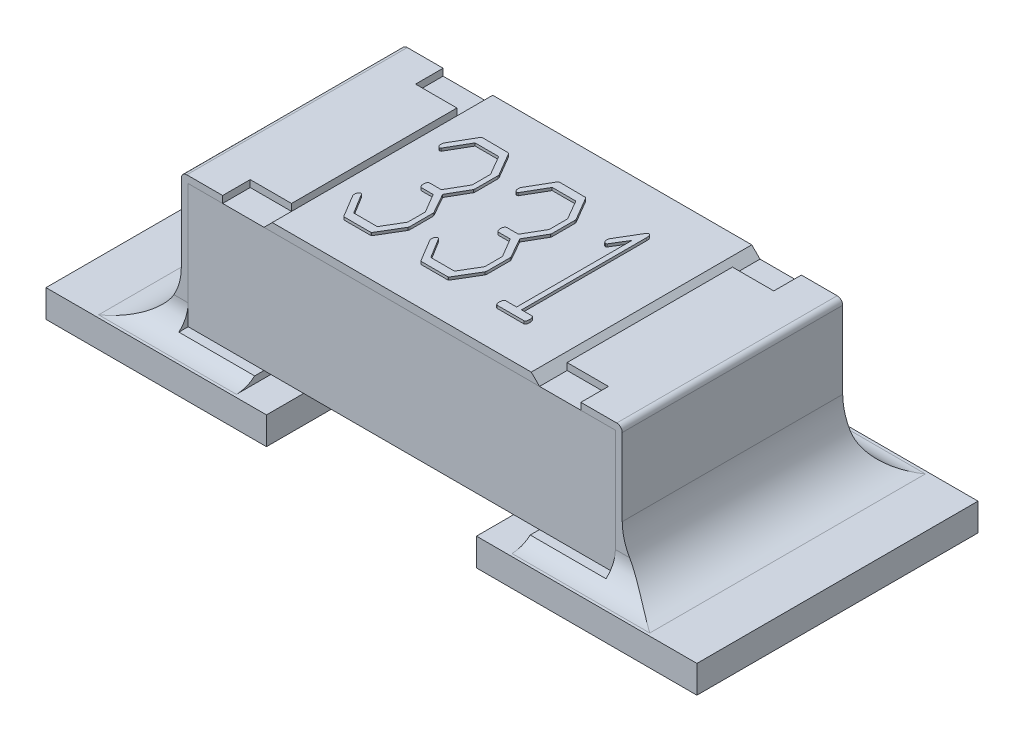
from build123d import *

# Parameters (mm, degrees)
SKETCH1_W             = 0.8
SKETCH1_H             = 0.45
BOSS_EXTRUDE1_DEPTH   = 0.775
BOSS_EXTRUDE2_DEPTH   = 0.4
BOSS_EXTRUDE2_2_DEPTH = 0.4
SKETCH3_W             = 0.15
SKETCH3_H             = 0.1
CUT_EXTRUDE1_DEPTH    = 0.025
BOSS_EXTRUDE3_DEPTH   = 0.4
BOSS_EXTRUDE4_DEPTH   = 0.01
SKETCH7_W             = 0.8
SKETCH7_H             = 1.02
BOSS_EXTRUDE5_DEPTH   = 0.1
FILLET3_R             = 0.2
FILLET4_R             = 0.2
FILLET5_R             = 0.1
FILLET6_R             = 0.1


with BuildPart() as part:
    # Sketch1 → Boss-Extrude1 (new, symmetric)
    with BuildSketch(Plane(origin=(0, 0, 0), x_dir=(0, 0, -1), z_dir=(1, 0, 0))):
        with Locations((0, 0.35)):
            Rectangle(SKETCH1_W, SKETCH1_H)
    extrude(amount=BOSS_EXTRUDE1_DEPTH, both=True)


with BuildPart() as body_2:
    # Sketch2 → Boss-Extrude2 (new, symmetric)
    with BuildSketch(Plane.XY):
        with BuildLine():
            Line((-0.5, 0.6), (-0.78, 0.6))
            ThreePointArc((-0.78, 0.6), (-0.794142136, 0.594142136), (-0.8, 0.58))
            Line((-0.8, 0.58), (-0.8, 0.1))
            Line((-0.8, 0.1), (-0.5, 0.1))
            Line((-0.5, 0.1), (-0.5, 0.125))
            Line((-0.5, 0.125), (-0.775, 0.125))
            Line((-0.775, 0.125), (-0.775, 0.575))
            Line((-0.775, 0.575), (-0.5, 0.575))
            Line((-0.5, 0.575), (-0.5, 0.6))
        make_face()
    extrude(amount=BOSS_EXTRUDE2_DEPTH, both=True)


with BuildPart() as body_3:
    # Sketch2 → Boss-Extrude2 2 (new, symmetric)
    with BuildSketch(Plane.XY):
        with BuildLine():
            Line((0.5, 0.575), (0.5, 0.6))
            Line((0.5, 0.6), (0.78, 0.6))
            ThreePointArc((0.78, 0.6), (0.794142136, 0.594142136), (0.8, 0.58))
            Line((0.8, 0.58), (0.8, 0.1))
            Line((0.8, 0.1), (0.5, 0.1))
            Line((0.5, 0.1), (0.5, 0.125))
            Line((0.5, 0.125), (0.775, 0.125))
            Line((0.775, 0.125), (0.775, 0.575))
            Line((0.775, 0.575), (0.5, 0.575))
        make_face()
    extrude(amount=BOSS_EXTRUDE2_2_DEPTH, both=True)


with BuildPart() as cut_extrude1_tool:
    # Sketch3 → Cut-Extrude1 (new body)
    with BuildSketch(Plane(origin=(0, 0.6, 0), x_dir=(1, 0, 0), z_dir=(0, 1, 0))):
        with Locations((-0.575, 0.35)):
            Rectangle(SKETCH3_W, SKETCH3_H)
        with Locations((-0.575, -0.35)):
            Rectangle(SKETCH3_W, SKETCH3_H)
        with Locations((0.575, -0.35)):
            Rectangle(SKETCH3_W, SKETCH3_H)
        with Locations((0.575, 0.35)):
            Rectangle(SKETCH3_W, SKETCH3_H)
    extrude(amount=-CUT_EXTRUDE1_DEPTH)


with BuildPart() as body_2_1:
    add(body_2.part)

    # Cut-Extrude1: cut by cut_extrude1_tool
    add(cut_extrude1_tool.part, mode=Mode.SUBTRACT)



with BuildPart() as body_3_1:
    add(body_3.part)

    # Cut-Extrude1: cut by cut_extrude1_tool
    add(cut_extrude1_tool.part, mode=Mode.SUBTRACT)


with BuildPart() as body_4:
    # Sketch4 → Boss-Extrude3 (new, symmetric)
    with BuildSketch(Plane.XY):
        Polygon((-0.5, 0.575), (0.5, 0.575), (0.47, 0.605), (-0.47, 0.605), align=None)
    extrude(amount=BOSS_EXTRUDE3_DEPTH, both=True)

    # Sketch6 → Boss-Extrude4 (add)
    with BuildSketch(Plane(origin=(0, 0.605, 0), x_dir=(1, 0, 0), z_dir=(0, 1, 0))):
        with BuildLine():
            Line((-0.246912202, 0.234002976), (-0.198456101, 0.151227679))
            Line((-0.198456101, 0.151227679), (-0.197619048, 0.145182292))
            Line((-0.197619048, 0.145182292), (-0.197619048, 0.063058036))
            Line((-0.197619048, 0.063058036), (-0.198828125, 0.058314732))
            Line((-0.198828125, 0.058314732), (-0.23937872, -0.012276786))
            Line((-0.23937872, -0.012276786), (-0.198828125, -0.084170387))
            Line((-0.198828125, -0.084170387), (-0.197619048, -0.08891369))
            Line((-0.197619048, -0.08891369), (-0.197619048, -0.172991071))
            Line((-0.197619048, -0.172991071), (-0.198828125, -0.178478423))
            Line((-0.198828125, -0.178478423), (-0.248214286, -0.26125372))
            Line((-0.248214286, -0.26125372), (-0.252213542, -0.261904762))
            Line((-0.252213542, -0.261904762), (-0.348195685, -0.261904762))
            Line((-0.348195685, -0.261904762), (-0.350613839, -0.259207589))
            Line((-0.350613839, -0.259207589), (-0.399627976, -0.177548363))
            add(Edge.make_bspline(
                [(-0.399627976, -0.177548363), (-0.399735366, -0.176681244), (-0.400006783, -0.174489697), (-0.400002555, -0.17228021), (-0.4, -0.17094494)],
                knots=[0, 0, 0, 0, 0.791330927, 2, 2, 2, 2], degree=3))
            add(Edge.make_bspline(
                [(-0.4, -0.17094494), (-0.400005712, -0.169980402), (-0.400014966, -0.168417682), (-0.399735103, -0.166882343), (-0.399627976, -0.166294643)],
                knots=[0, 0, 0, 0, 1.234435563, 2, 2, 2, 2], degree=3))
            add(Edge.make_bspline(
                [(-0.399627976, -0.166294643), (-0.399297743, -0.165050815), (-0.398689007, -0.162758001), (-0.396796108, -0.160041395), (-0.394746995, -0.157801232), (-0.392913317, -0.157262127), (-0.392001488, -0.156994048)],
                knots=[0, 0, 0, 0, 1.206652828, 2.224285909, 3.116994777, 4, 4, 4, 4], degree=3))
            add(Edge.make_bspline(
                [(-0.392001488, -0.156994048), (-0.390666654, -0.15729556), (-0.387649437, -0.157977088), (-0.386084599, -0.160689792), (-0.385212054, -0.162202381)],
                knots=[0, 0, 0, 0, 0.884811277, 2, 2, 2, 2], degree=3))
            Line((-0.385212054, -0.162202381), (-0.342243304, -0.232142857))
            Line((-0.342243304, -0.232142857), (-0.256491815, -0.232142857))
            Line((-0.256491815, -0.232142857), (-0.21547619, -0.16313244))
            Line((-0.21547619, -0.16313244), (-0.21547619, -0.098772321))
            Line((-0.21547619, -0.098772321), (-0.25639881, -0.029761905))
            Line((-0.25639881, -0.029761905), (-0.300390625, -0.029761905))
            add(Edge.make_bspline(
                [(-0.300390625, -0.029761905), (-0.301388222, -0.029049571), (-0.303450502, -0.027577), (-0.305383911, -0.023897974), (-0.30657995, -0.019363369), (-0.306667482, -0.015976601), (-0.30671503, -0.014136905)],
                knots=[0, 0, 0, 0, 0.823895179, 1.703194927, 2.752372739, 4, 4, 4, 4], degree=3))
            add(Edge.make_bspline(
                [(-0.30671503, -0.014136905), (-0.306591968, -0.012090481), (-0.306354099, -0.008134877), (-0.304715651, -0.004530053), (-0.303924851, -0.002790179)],
                knots=[0, 0, 0, 0, 1.034696418, 2, 2, 2, 2], degree=3))
            add(Edge.make_bspline(
                [(-0.303924851, -0.002790179), (-0.303111447, -0.001956226), (-0.301320079, -0.000119606), (-0.298733514, -4.2238e-05), (-0.297321429, 0)],
                knots=[0, 0, 0, 0, 0.908138185, 2, 2, 2, 2], degree=3))
            Line((-0.297321429, 0), (-0.25639881, 0))
            Line((-0.25639881, 0), (-0.21547619, 0.07077753))
            Line((-0.21547619, 0.07077753), (-0.21547619, 0.137555804))
            Line((-0.21547619, 0.137555804), (-0.256491815, 0.208333333))
            Line((-0.256491815, 0.208333333), (-0.342243304, 0.208333333))
            Line((-0.342243304, 0.208333333), (-0.387630208, 0.130208333))
            add(Edge.make_bspline(
                [(-0.387630208, 0.130208333), (-0.388357871, 0.129817639), (-0.389620694, 0.129139609), (-0.391031564, 0.128910385), (-0.391629464, 0.128813244)],
                knots=[0, 0, 0, 0, 1.152437574, 2, 2, 2, 2], degree=3))
            add(Edge.make_bspline(
                [(-0.391629464, 0.128813244), (-0.392807912, 0.129002619), (-0.39532525, 0.129407153), (-0.398122994, 0.132865271), (-0.399842375, 0.137855724), (-0.39994275, 0.14181055), (-0.4, 0.14406622)],
                knots=[0, 0, 0, 0, 0.723786097, 1.5461138, 2.600403721, 4, 4, 4, 4], degree=3))
            Line((-0.4, 0.14406622), (-0.399162946, 0.150297619))
            Line((-0.399162946, 0.150297619), (-0.349869792, 0.23530506))
            Line((-0.349869792, 0.23530506), (-0.346707589, 0.238095238))
            Line((-0.346707589, 0.238095238), (-0.249702381, 0.237444196))
            Line((-0.249702381, 0.237444196), (-0.246912202, 0.234002976))
        make_face()
        with BuildLine():
            Line((0.032849702, 0.234002976), (0.081305804, 0.151227679))
            Line((0.081305804, 0.151227679), (0.082142857, 0.145182292))
            Line((0.082142857, 0.145182292), (0.082142857, 0.063058036))
            Line((0.082142857, 0.063058036), (0.08093378, 0.058314732))
            Line((0.08093378, 0.058314732), (0.040383185, -0.012276786))
            Line((0.040383185, -0.012276786), (0.08093378, -0.084170387))
            Line((0.08093378, -0.084170387), (0.082142857, -0.08891369))
            Line((0.082142857, -0.08891369), (0.082142857, -0.172991071))
            Line((0.082142857, -0.172991071), (0.08093378, -0.178478423))
            Line((0.08093378, -0.178478423), (0.031547619, -0.26125372))
            Line((0.031547619, -0.26125372), (0.027548363, -0.261904762))
            Line((0.027548363, -0.261904762), (-0.06843378, -0.261904762))
            Line((-0.06843378, -0.261904762), (-0.070851935, -0.259207589))
            Line((-0.070851935, -0.259207589), (-0.119866071, -0.177548363))
            add(Edge.make_bspline(
                [(-0.119866071, -0.177548363), (-0.119973462, -0.176681244), (-0.120244878, -0.174489697), (-0.12024065, -0.17228021), (-0.120238095, -0.17094494)],
                knots=[0, 0, 0, 0, 0.791330927, 2, 2, 2, 2], degree=3))
            add(Edge.make_bspline(
                [(-0.120238095, -0.17094494), (-0.120243807, -0.169980402), (-0.120253061, -0.168417682), (-0.119973198, -0.166882343), (-0.119866071, -0.166294643)],
                knots=[0, 0, 0, 0, 1.234435563, 2, 2, 2, 2], degree=3))
            add(Edge.make_bspline(
                [(-0.119866071, -0.166294643), (-0.119535838, -0.165050815), (-0.118927102, -0.162758001), (-0.117034204, -0.160041395), (-0.114985091, -0.157801232), (-0.113151412, -0.157262127), (-0.112239583, -0.156994048)],
                knots=[0, 0, 0, 0, 1.206652828, 2.224285909, 3.116994777, 4, 4, 4, 4], degree=3))
            add(Edge.make_bspline(
                [(-0.112239583, -0.156994048), (-0.110904749, -0.15729556), (-0.107887532, -0.157977088), (-0.106322694, -0.160689792), (-0.105450149, -0.162202381)],
                knots=[0, 0, 0, 0, 0.884811277, 2, 2, 2, 2], degree=3))
            Line((-0.105450149, -0.162202381), (-0.062481399, -0.232142857))
            Line((-0.062481399, -0.232142857), (0.023270089, -0.232142857))
            Line((0.023270089, -0.232142857), (0.064285714, -0.16313244))
            Line((0.064285714, -0.16313244), (0.064285714, -0.098772321))
            Line((0.064285714, -0.098772321), (0.023363095, -0.029761905))
            Line((0.023363095, -0.029761905), (-0.02062872, -0.029761905))
            add(Edge.make_bspline(
                [(-0.02062872, -0.029761905), (-0.021626317, -0.029049571), (-0.023688597, -0.027577), (-0.025622006, -0.023897974), (-0.026818045, -0.019363369), (-0.026905577, -0.015976601), (-0.026953125, -0.014136905)],
                knots=[0, 0, 0, 0, 0.823895179, 1.703194927, 2.752372739, 4, 4, 4, 4], degree=3))
            add(Edge.make_bspline(
                [(-0.026953125, -0.014136905), (-0.026830064, -0.012090481), (-0.026592194, -0.008134877), (-0.024953746, -0.004530053), (-0.024162946, -0.002790179)],
                knots=[0, 0, 0, 0, 1.034696418, 2, 2, 2, 2], degree=3))
            add(Edge.make_bspline(
                [(-0.024162946, -0.002790179), (-0.023349542, -0.001956226), (-0.021558174, -0.000119606), (-0.018971609, -4.2238e-05), (-0.017559524, 0)],
                knots=[0, 0, 0, 0, 0.908138185, 2, 2, 2, 2], degree=3))
            Line((-0.017559524, 0), (0.023363095, 0))
            Line((0.023363095, 0), (0.064285714, 0.07077753))
            Line((0.064285714, 0.07077753), (0.064285714, 0.137555804))
            Line((0.064285714, 0.137555804), (0.023270089, 0.208333333))
            Line((0.023270089, 0.208333333), (-0.062481399, 0.208333333))
            Line((-0.062481399, 0.208333333), (-0.107868304, 0.130208333))
            add(Edge.make_bspline(
                [(-0.107868304, 0.130208333), (-0.108595966, 0.129817639), (-0.109858789, 0.129139609), (-0.111269659, 0.128910385), (-0.11186756, 0.128813244)],
                knots=[0, 0, 0, 0, 1.152437574, 2, 2, 2, 2], degree=3))
            add(Edge.make_bspline(
                [(-0.11186756, 0.128813244), (-0.113046007, 0.129002619), (-0.115563345, 0.129407153), (-0.118361089, 0.132865271), (-0.120080471, 0.137855724), (-0.120180845, 0.14181055), (-0.120238095, 0.14406622)],
                knots=[0, 0, 0, 0, 0.723786097, 1.5461138, 2.600403721, 4, 4, 4, 4], degree=3))
            Line((-0.120238095, 0.14406622), (-0.119401042, 0.150297619))
            Line((-0.119401042, 0.150297619), (-0.070107887, 0.23530506))
            Line((-0.070107887, 0.23530506), (-0.066945685, 0.238095238))
            Line((-0.066945685, 0.238095238), (0.030059524, 0.237444196))
            Line((0.030059524, 0.237444196), (0.032849702, 0.234002976))
        make_face()
        with BuildLine():
            Line((0.266666667, 0.221819196), (0.266666667, -0.232142857))
            Line((0.266666667, -0.232142857), (0.305915179, -0.232142857))
            add(Edge.make_bspline(
                [(0.305915179, -0.232142857), (0.307008894, -0.233159523), (0.309177687, -0.235175528), (0.31060257, -0.239323698), (0.311571809, -0.243100354), (0.3117123, -0.245561302), (0.311774554, -0.246651786)],
                knots=[0, 0, 0, 0, 1.094507773, 2.170363376, 3.18925981, 4, 4, 4, 4], degree=3))
            add(Edge.make_bspline(
                [(0.311774554, -0.246651786), (0.311733799, -0.24890061), (0.311663298, -0.252790757), (0.310596181, -0.257670974), (0.308566678, -0.261266063), (0.306359471, -0.261705298), (0.305357143, -0.261904762)],
                knots=[0, 0, 0, 0, 1.483935822, 2.566997854, 3.349251094, 4, 4, 4, 4], degree=3))
            Line((0.305357143, -0.261904762), (0.207235863, -0.261904762))
            add(Edge.make_bspline(
                [(0.207235863, -0.261904762), (0.206331965, -0.261383497), (0.204385532, -0.260261018), (0.202678784, -0.256793507), (0.201738841, -0.252323852), (0.201625713, -0.248923727), (0.2015625, -0.24702381)],
                knots=[0, 0, 0, 0, 0.731657516, 1.575533429, 2.645259425, 4, 4, 4, 4], degree=3))
            add(Edge.make_bspline(
                [(0.2015625, -0.24702381), (0.201676748, -0.245999991), (0.201980401, -0.24327885), (0.202668126, -0.239634421), (0.20377287, -0.236384481), (0.204808452, -0.234196716), (0.206398369, -0.232808963), (0.207591916, -0.232359173), (0.208165923, -0.232142857)],
                knots=[0, 0, 0, 0, 1.077846596, 2.864738214, 3.859388994, 4.671949365, 5.361307703, 6, 6, 6, 6], degree=3))
            Line((0.208165923, -0.232142857), (0.248809524, -0.232142857))
            Line((0.248809524, -0.232142857), (0.248809524, 0.186476935))
            Line((0.248809524, 0.186476935), (0.214304315, 0.130208333))
            add(Edge.make_bspline(
                [(0.214304315, 0.130208333), (0.213576779, 0.129816395), (0.21228718, 0.129121662), (0.210841948, 0.128906863), (0.210212054, 0.128813244)],
                knots=[0, 0, 0, 0, 1.128313794, 2, 2, 2, 2], degree=3))
            add(Edge.make_bspline(
                [(0.210212054, 0.128813244), (0.209582159, 0.128906863), (0.208136928, 0.129121662), (0.206847328, 0.129816395), (0.206119792, 0.130208333)],
                knots=[0, 0, 0, 0, 0.871686206, 2, 2, 2, 2], degree=3))
            add(Edge.make_bspline(
                [(0.206119792, 0.130208333), (0.204761774, 0.132029405), (0.201865732, 0.135912935), (0.201424699, 0.140752164), (0.201190476, 0.143322173)],
                knots=[0, 0, 0, 0, 0.937843913, 2, 2, 2, 2], degree=3))
            Line((0.201190476, 0.143322173), (0.202399554, 0.150297619))
            Line((0.202399554, 0.150297619), (0.252622768, 0.234654018))
            add(Edge.make_bspline(
                [(0.252622768, 0.234654018), (0.253471085, 0.23565958), (0.254907743, 0.23736254), (0.257047735, 0.237882361), (0.257924107, 0.238095238)],
                knots=[0, 0, 0, 0, 1.180958283, 2, 2, 2, 2], degree=3))
            add(Edge.make_bspline(
                [(0.257924107, 0.238095238), (0.259269262, 0.237901979), (0.262027645, 0.23750568), (0.265037819, 0.233775342), (0.266429179, 0.228376002), (0.266579771, 0.224218313), (0.266666667, 0.221819196)],
                knots=[0, 0, 0, 0, 0.76869288, 1.576286457, 2.601441333, 4, 4, 4, 4], degree=3))
        make_face()
    extrude(amount=BOSS_EXTRUDE4_DEPTH)


with BuildPart() as body_2_2:
    add(body_2_1.part)

    add(body_3_1.part)  # Boss-Extrude5 merges body 3
    # Sketch7 → Boss-Extrude5 (add)
    with BuildSketch(Plane(origin=(0, 0, 0), x_dir=(1, 0, 0), z_dir=(0, 1, 0))):
        with Locations((-0.781, 0)):
            Rectangle(SKETCH7_W, SKETCH7_H)
        with Locations((0.781, 0)):
            Rectangle(SKETCH7_W, SKETCH7_H)
    extrude(amount=BOSS_EXTRUDE5_DEPTH)

    # Fillet3
    fillet3_edges = [body_2_2.edges().sort_by_distance(p)[0] for p in [
        (-0.8, 0.1, 0),
    ]]
    fillet(fillet3_edges, radius=FILLET3_R)

    # Fillet4
    fillet4_edges = [body_2_2.edges().sort_by_distance(p)[0] for p in [
        (0.8, 0.1, 0),
    ]]
    fillet(fillet4_edges, radius=FILLET4_R)

    # Fillet5
    fillet5_edges = [body_2_2.edges().sort_by_distance(p)[0] for p in [
        (0.75, 0.1, 0.4),
    ]]
    fillet(fillet5_edges, radius=FILLET5_R)
    fillet5_2_edges = [body_2_2.edges().sort_by_distance(p)[0] for p in [
        (0.75, 0.1, -0.4),
    ]]
    fillet(fillet5_2_edges, radius=FILLET5_R)

    # Fillet6
    fillet6_edges = [body_2_2.edges().sort_by_distance(p)[0] for p in [
        (-0.75, 0.1, -0.4),
    ]]
    fillet(fillet6_edges, radius=FILLET6_R)
    fillet6_2_edges = [body_2_2.edges().sort_by_distance(p)[0] for p in [
        (-0.75, 0.1, 0.4),
    ]]
    fillet(fillet6_2_edges, radius=FILLET6_R)


solid = Compound([part.part, body_4.part, body_2_2.part])
